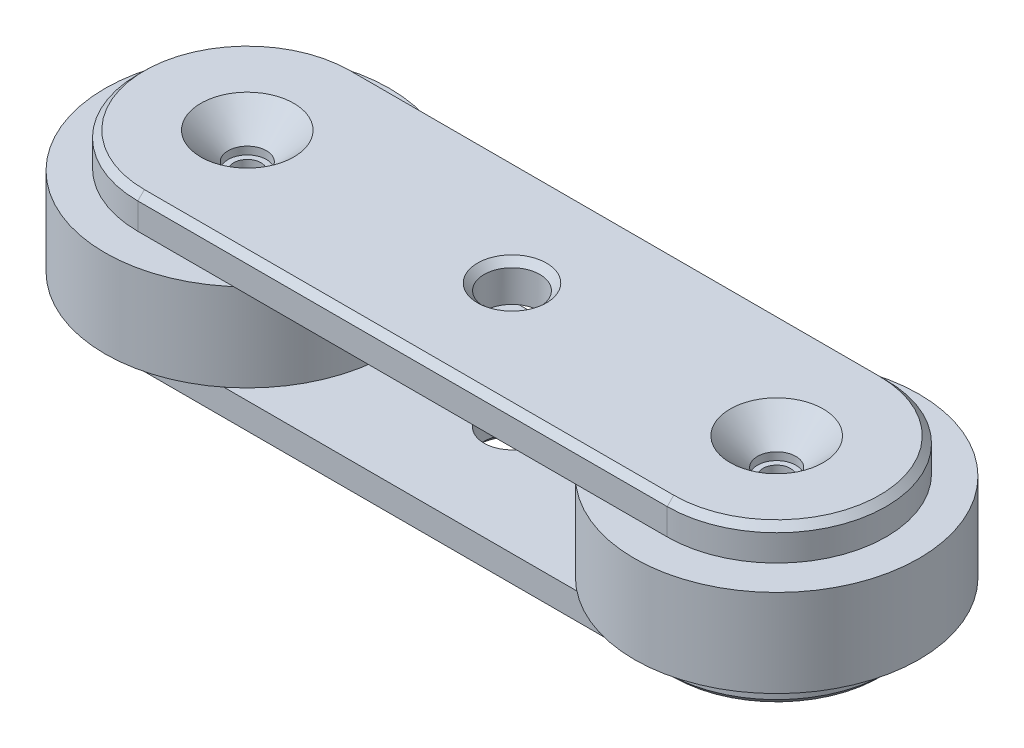
from build123d import *
from build123d.topology import SkipClean

# Parameters (mm, degrees)
SKETCH1_R            = 2.55
BOSS_EXTRUDE1_DEPTH  = 3
SKETCH10_R           = 7.5
BOSS_EXTRUDE6_DEPTH  = 0.2
SKETCH11_R           = 5.05
BOSS_EXTRUDE8_DEPTH  = 8
SKETCH12_R           = 13
SKETCH12_R_2         = 5
BOSS_EXTRUDE9_DEPTH  = 8
SKETCH13_R           = 1.25
CUT_EXTRUDE6_DEPTH   = 41.944115878
SKETCH14_R           = 2.55
SKETCH14_R_2         = 1.75
BOSS_EXTRUDE10_DEPTH = 3
BOSS_EXTRUDE11_START = 0.2
SKETCH15_R           = 7.5
SKETCH15_R_2         = 1.75
BOSS_EXTRUDE11_DEPTH = 0.2
CHAMFER1_SIZE        = 2.5
CHAMFER2_SIZE        = 0.6
BOSS_EXTRUDE12_DEPTH = 0.5
BOSS_EXTRUDE13_START = 0.5
BOSS_EXTRUDE13_DEPTH = 0.5
CHAMFER3_SIZE        = 0.6


with BuildPart() as part:
    # Sketch1 → Boss-Extrude1 (new body)
    with BuildSketch(Plane(origin=(0, 0, 0), x_dir=(1, 0, 0), z_dir=(0, 1, 0))):
        with BuildLine():
            Line((24.175, -10), (-24.175, -10))
            ThreePointArc((-24.175, -10), (-34.175, 0), (-24.175, 10))
            Line((-24.175, 10), (24.175, 10))
            ThreePointArc((24.175, 10), (34.175, 0), (24.175, -10))
        make_face()
        Circle(SKETCH1_R, mode=Mode.SUBTRACT)
    extrude(amount=BOSS_EXTRUDE1_DEPTH)

    # Sketch10 → Boss-Extrude6 (add)
    with BuildSketch(Plane(origin=(0, 3, 0), x_dir=(1, 0, 0), z_dir=(0, 1, 0))):
        with Locations((-24.175, 0)):
            Circle(SKETCH10_R)
        with Locations((24.175, 0)):
            Circle(SKETCH10_R)
    extrude(amount=BOSS_EXTRUDE6_DEPTH)

    # Sketch11 → Boss-Extrude8 (add)
    with BuildSketch(Plane(origin=(0, 3.2, 0), x_dir=(1, 0, 0), z_dir=(0, 1, 0))):
        with Locations((-24.175, 0)):
            Circle(SKETCH11_R)
        with Locations((24.175, 0)):
            Circle(SKETCH11_R)
    extrude(amount=BOSS_EXTRUDE8_DEPTH)

    # Sketch13 → Cut-Extrude6 (cut, through all)
    with BuildSketch(Plane(origin=(0, 11.2, 0), x_dir=(1, 0, 0), z_dir=(0, 1, 0))):
        with Locations((-24.175, 0)):
            Circle(SKETCH13_R)
        with Locations((24.175, 0)):
            Circle(SKETCH13_R)
    extrude(amount=-CUT_EXTRUDE6_DEPTH, mode=Mode.SUBTRACT)

    # Sketch16 → Boss-Extrude12 (add)
    with SkipClean():  # the faces are left unmerged after this step: merging them gives an invalid solid
        with BuildSketch(Plane(origin=(0, 3, 0), x_dir=(1, 0, 0), z_dir=(0, 1, 0))):
            with BuildLine():
                Line((-10, 0), (-2.55, 0))
                ThreePointArc((-2.55, 0), (0, 2.55), (2.55, 0))
                Line((2.55, 0), (10, 0))
                ThreePointArc((10, 0), (0, 10), (-10, 0))
            make_face()
        extrude(amount=BOSS_EXTRUDE12_DEPTH)

    # Chamfer3
    chamfer3_edges = [part.edges().sort_by_distance(p)[0] for p in [
        (22.925, 0, 0),
        (-2.55, 0, 0),
        (-25.425, 0, 0),
        (34.175, 0, 0),
        (0, 0, -10),
        (0, 0, 10),
        (-34.175, 0, 0),
    ]]
    chamfer(chamfer3_edges, length=CHAMFER3_SIZE)


with BuildPart() as body_2:
    # Sketch12 → Boss-Extrude9 (new body)
    with BuildSketch(Plane(origin=(0, 3.2, 0), x_dir=(1, 0, 0), z_dir=(0, 1, 0))):
        with Locations((-24.175, 0)):
            Circle(SKETCH12_R)
        with Locations((-24.175, 0)):
            Circle(SKETCH12_R_2, mode=Mode.SUBTRACT)
    extrude(amount=BOSS_EXTRUDE9_DEPTH)


with BuildPart() as body_3:
    # Mirror3: mirrored copy
    add(body_2.part.mirror(Plane(origin=(0, 0, 0), x_dir=(0, 0, 1), z_dir=(1, 0, 0))))


with BuildPart() as body_4:
    # Sketch14 → Boss-Extrude10 (new body)
    with BuildSketch(Plane(origin=(0, 11.4, 0), x_dir=(1, 0, 0), z_dir=(0, 1, 0))):
        with BuildLine():
            Line((-24.175, -10), (24.175, -10))
            ThreePointArc((24.175, -10), (34.175, 0), (24.175, 10))
            Line((24.175, 10), (-24.175, 10))
            ThreePointArc((-24.175, 10), (-34.175, 0), (-24.175, -10))
        make_face()
        Circle(SKETCH14_R, mode=Mode.SUBTRACT)
        with Locations((-24.175, 0)):
            Circle(SKETCH14_R_2, mode=Mode.SUBTRACT)
        with Locations((24.175, 0)):
            Circle(SKETCH14_R_2, mode=Mode.SUBTRACT)
    extrude(amount=BOSS_EXTRUDE10_DEPTH)

    # Sketch15 → Boss-Extrude11 (add)
    # profile 1 of 2: a face of its own
    with BuildSketch(Plane.XZ.offset(-11.4).offset(BOSS_EXTRUDE11_START)):
        with Locations((24.175, 0)):
            Circle(SKETCH15_R)
        with Locations((24.175, 0)):
            Circle(SKETCH15_R_2, mode=Mode.SUBTRACT)
    # profile 2 of 2: a face of its own
    with BuildSketch(Plane.XZ.offset(-11.4).offset(BOSS_EXTRUDE11_START)):
        with Locations((-24.175, 0)):
            Circle(SKETCH15_R)
        with Locations((-24.175, 0)):
            Circle(SKETCH15_R_2, mode=Mode.SUBTRACT)
    extrude(amount=-BOSS_EXTRUDE11_DEPTH)

    # Chamfer1
    chamfer1_edges = [body_4.edges().sort_by_distance(p)[0] for p in [
        (-25.925, 14.4, 0),
        (22.425, 14.4, 0),
    ]]
    chamfer(chamfer1_edges, length=CHAMFER1_SIZE)

    # Chamfer2
    chamfer2_edges = [body_4.edges().sort_by_distance(p)[0] for p in [
        (0, 14.4, 10),
        (34.175, 14.4, 0),
        (-34.175, 14.4, 0),
        (0, 14.4, -10),
        (-2.55, 14.4, 0),
    ]]
    chamfer(chamfer2_edges, length=CHAMFER2_SIZE)

    # Sketch17 → Boss-Extrude13 (add)
    with BuildSketch(Plane.XZ.offset(-11.4).offset(BOSS_EXTRUDE13_START)):
        with BuildLine():
            Line((-2.55, 0), (-10, 0))
            ThreePointArc((-10, 0), (0, -10), (10, 0))
            Line((10, 0), (2.55, 0))
            ThreePointArc((2.55, 0), (0, -2.55), (-2.55, 0))
        make_face()
    extrude(amount=-BOSS_EXTRUDE13_DEPTH)


solid = Compound([part.part, body_2.part, body_3.part, body_4.part])
